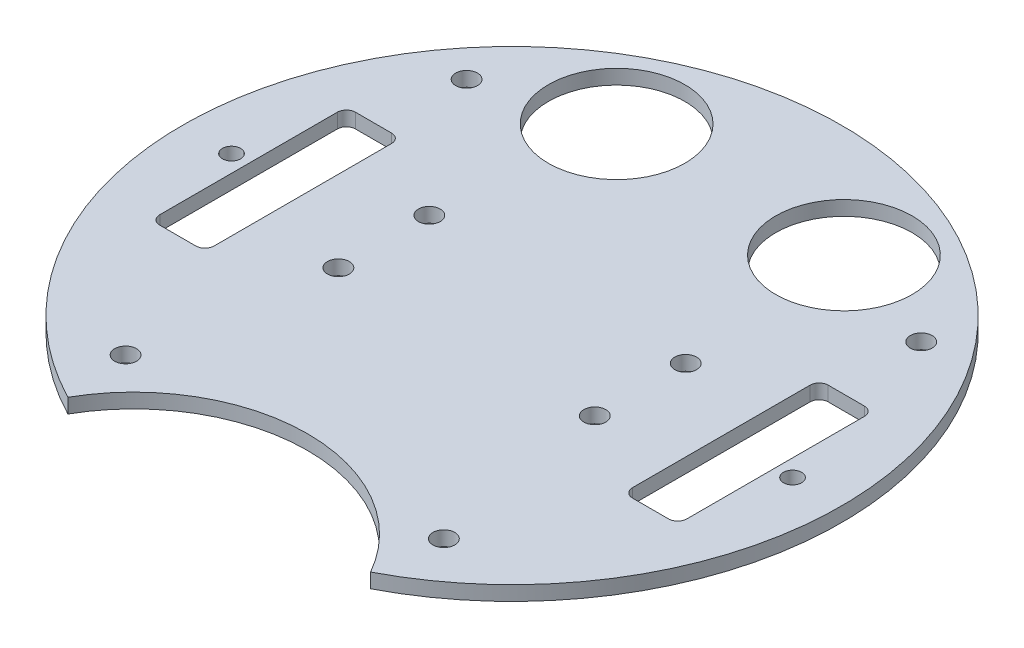
from build123d import *

# Parameters (mm, degrees)
BOSS_EXTRUDE1_DEPTH = 3.2
SKETCH2_W           = 10.76
SKETCH2_H           = 41.868700306
CUT_EXTRUDE1_DEPTH  = 103.580407486
SKETCH3_R           = 2
SKETCH3_R_2         = 2.4
CUT_EXTRUDE2_DEPTH  = 103.580407486
SKETCH4_R           = 15
CUT_EXTRUDE3_DEPTH  = 103.580407486
CUT_EXTRUDE4_DEPTH  = 103.580407486
SKETCH6_R           = 2.4
CUT_EXTRUDE5_DEPTH  = 103.580407486


with BuildPart() as part:
    # Sketch1 → Boss-Extrude1 (new body)
    with BuildSketch(Plane(origin=(0, 0, 0), x_dir=(1, 0, 0), z_dir=(0, 1, 0))):
        with BuildLine():
            ThreePointArc((33.29110537, -64.404598464), (0, 72.5), (-33.29110537, -64.404598464))
            ThreePointArc((-33.29110537, -64.404598464), (0, -44.989799638), (33.29110537, -64.404598464))
        make_face()
    extrude(amount=BOSS_EXTRUDE1_DEPTH)

    # Sketch2 → Cut-Extrude1 (cut, through all)
    with BuildSketch(Plane(origin=(0, 3.2, 0), x_dir=(1, 0, 0), z_dir=(0, 1, 0))):
        with Locations((-51.99, 0)):
            Rectangle(SKETCH2_W, SKETCH2_H)
        with Locations((51.99, 0)):
            Rectangle(SKETCH2_W, SKETCH2_H)
    extrude(amount=-CUT_EXTRUDE1_DEPTH, mode=Mode.SUBTRACT)

    # Sketch3 → Cut-Extrude2 (cut, through all)
    with BuildSketch(Plane.XZ):
        with Locations((-61.7, 0)):
            Circle(SKETCH3_R)
        with Locations((-28.2, 10)):
            Circle(SKETCH3_R_2)
        with Locations((-28.2, -10)):
            Circle(SKETCH3_R_2)
        with Locations((28.2, -10)):
            Circle(SKETCH3_R_2)
        with Locations((28.2, 10)):
            Circle(SKETCH3_R_2)
        with Locations((61.7, 0)):
            Circle(SKETCH3_R)
    extrude(amount=-CUT_EXTRUDE2_DEPTH, mode=Mode.SUBTRACT)

    # Sketch4 → Cut-Extrude3 (cut, through all)
    with BuildSketch(Plane(origin=(0, 3.2, 0), x_dir=(1, 0, 0), z_dir=(0, 1, 0))):
        with Locations((-25, 48)):
            Circle(SKETCH4_R)
        with Locations((25, 48)):
            Circle(SKETCH4_R)
    extrude(amount=-CUT_EXTRUDE3_DEPTH, mode=Mode.SUBTRACT)

    # Sketch5 → Cut-Extrude4 (cut, through all)
    with BuildSketch(Plane(origin=(0, 3.2, 0), x_dir=(1, 0, 0), z_dir=(0, 1, 0))):
        with BuildLine():
            Line((-55.955786438, 21.520136591), (-48.024213562, 21.520136591))
            ThreePointArc((-48.024213562, 21.520136591), (-46.61, 20.934350153), (-46.024213562, 19.520136591))
            Line((-46.024213562, 19.520136591), (-46.024213562, -19.520136591))
            ThreePointArc((-46.024213562, -19.520136591), (-46.61, -20.934350153), (-48.024213562, -21.520136591))
            Line((-48.024213562, -21.520136591), (-55.955786438, -21.520136591))
            ThreePointArc((-55.955786438, -21.520136591), (-57.37, -20.934350153), (-57.955786438, -19.520136591))
            Line((-57.955786438, -19.520136591), (-57.955786438, 19.520136591))
            ThreePointArc((-57.955786438, 19.520136591), (-57.37, 20.934350153), (-55.955786438, 21.520136591))
        make_face()
        with BuildLine():
            Line((46.024213562, 19.520136591), (46.024213562, -19.520136591))
            ThreePointArc((46.024213562, -19.520136591), (46.61, -20.934350153), (48.024213562, -21.520136591))
            Line((48.024213562, -21.520136591), (55.955786438, -21.520136591))
            ThreePointArc((55.955786438, -21.520136591), (57.37, -20.934350153), (57.955786438, -19.520136591))
            Line((57.955786438, -19.520136591), (57.955786438, 19.520136591))
            ThreePointArc((57.955786438, 19.520136591), (57.37, 20.934350153), (55.955786438, 21.520136591))
            Line((55.955786438, 21.520136591), (48.024213562, 21.520136591))
            ThreePointArc((48.024213562, 21.520136591), (46.61, 20.934350153), (46.024213562, 19.520136591))
        make_face()
    extrude(amount=-CUT_EXTRUDE4_DEPTH, mode=Mode.SUBTRACT)

    # Sketch6 → Cut-Extrude5 (cut, through all)
    with BuildSketch(Plane(origin=(0, 3.2, 0), x_dir=(1, 0, 0), z_dir=(0, 1, 0))):
        with Locations((-50, 40)):
            Circle(SKETCH6_R)
        with Locations((-35, -50)):
            Circle(SKETCH6_R)
        with Locations((35, -50)):
            Circle(SKETCH6_R)
        with Locations((50, 40)):
            Circle(SKETCH6_R)
    extrude(amount=-CUT_EXTRUDE5_DEPTH, mode=Mode.SUBTRACT)


solid = part.part
